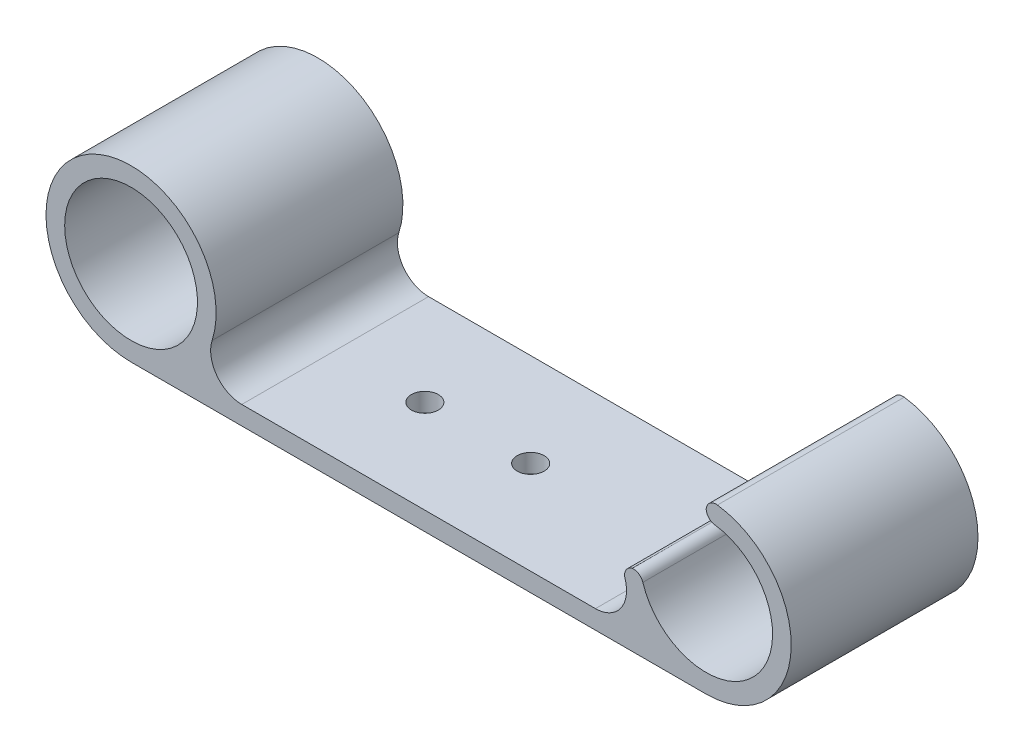
from build123d import *

# Parameters (mm, degrees)
SKETCH3_W           = 114.3
SKETCH3_H           = 38.1
BOSS_EXTRUDE1_DEPTH = 3.81
SKETCH4_R           = 13.5453125
BOSS_EXTRUDE2_DEPTH = 19.05
FILLET1_R           = 2.032
SKETCH5_R           = 2.749999961
CUT_EXTRUDE4_DEPTH  = 12.7


with BuildPart() as part:
    # Sketch3 → Boss-Extrude1 (new body)
    with BuildSketch(Plane(origin=(0, 0, 0), x_dir=(1, 0, 0), z_dir=(0, 1, 0))):
        Rectangle(SKETCH3_W, SKETCH3_H)
    extrude(amount=BOSS_EXTRUDE1_DEPTH)

    # Sketch4 → Boss-Extrude2 (add, symmetric)
    with BuildSketch(Plane.XY):
        with BuildLine():
            Line((-36.071859255, 3.81), (36.071859255, 3.81))
            ThreePointArc((36.071859255, 3.81), (41.198342199, 6.412778013), (42.122274879, 12.087425946))
            ThreePointArc((42.122274879, 12.087425946), (41.806974837, 13.2052175), (41.567140999, 14.341594112))
            Line((41.567140999, 14.341594112), (45.319258538, 15.003193668))
            ThreePointArc((45.319258538, 15.003193668), (67.365546349, 6.979001129), (63.291557028, 30.083742702))
            ThreePointArc((63.291557028, 30.083742702), (61.010906137, 30.694841267), (58.658787305, 30.900625))
            Line((58.658787305, 30.900625), (58.658787305, 34.710625))
            ThreePointArc((58.658787305, 34.710625), (61.672505693, 34.446958806), (64.594653774, 33.663971588))
            ThreePointArc((64.594653774, 33.663971588), (75.750433611, 14.341594112), (58.658787305, 0))
            Line((58.658787305, 0), (-58.658787305, 0))
            ThreePointArc((-58.658787305, 0), (-70.930846463, 5.083253342), (-76.014099805, 17.3553125))
            ThreePointArc((-76.014099805, 17.3553125), (-55.993216901, 34.504703346), (-42.122274879, 12.087425946))
            ThreePointArc((-42.122274879, 12.087425946), (-41.198342199, 6.412778013), (-36.071859255, 3.81))
        make_face()
        with Locations(Location((-58.658787305, 17.3553125, 0), (0, 0, 180))):
            Circle(SKETCH4_R, mode=Mode.SUBTRACT)
    extrude(amount=BOSS_EXTRUDE2_DEPTH, both=True)

    # Fillet1
    # the kernel refuses this fillet: 2.032 mm, written as the material it takes off along each edge
    with BuildSketch(Plane(origin=(58.658787305, 34.710625, 0), x_dir=(0, -1, 0), z_dir=(0, 0, -1)), Plane(origin=(41.567140999, 14.341594112, 0), x_dir=(0.9848077530122078, 0.17364817766693208, 0), z_dir=(0, 0, 1))) as fillet1_piece_1:
        with BuildLine():
            CenterArc((2.16732771, -2.032), FILLET1_R, 90, 97.620348072)
            ThreePointArc((0.153273302, -2.301460275), (0.03836072, -1.153279249), (0, 0))
            Line((0, 0), (2.16732771, 0))
        make_face()
    extrude(amount=24.816396244, mode=Mode.SUBTRACT)
    with BuildSketch(Plane(origin=(58.658787305, 30.900625, 0), x_dir=(0.9978615634411592, -0.06536283505758803, 0), z_dir=(0, 0, -1)), Plane(origin=(45.319258538, 15.003193668, 0), x_dir=(0.23764666877900192, -0.9713516669148425, 0), z_dir=(0, 0, 1))) as fillet1_piece_2:
        with BuildLine():
            CenterArc((1.903537334, -2.027654697), FILLET1_R, 93.747686363, 82.504627273)
            Line((-0.124117363, -1.894837416), (0, 0))
            ThreePointArc((0, 0), (0.885360027, -0.028965791), (1.770720053, 0))
        make_face()
    extrude(amount=23.797245223, mode=Mode.SUBTRACT)
    with BuildSketch(Plane(origin=(45.319258538, 15.003193668, 0), x_dir=(-0.9848077530122076, -0.17364817766693288, 0), z_dir=(0, 0, -1)), Plane(origin=(58.658787305, 30.900625, 0), x_dir=(0, 1, 0), z_dir=(0, 0, 1))) as fillet1_piece_3:
        with BuildLine():
            CenterArc((1.898898089, -2.032), FILLET1_R, 90, 82.504627273)
            ThreePointArc((-0.115739283, -1.766933481), (-0.028965791, -0.885360027), (0, 0))
            Line((0, 0), (1.898898089, 0))
        make_face()
    extrude(amount=23.797245223, mode=Mode.SUBTRACT)
    with BuildSketch(Plane(origin=(41.567140999, 14.341594112, 0), x_dir=(0.23870589854739682, -0.9710919081110089, 0), z_dir=(0, 0, -1)), Plane(origin=(58.658787305, 34.710625, 0), x_dir=(0.9977896842762429, -0.06645107938864023, 0), z_dir=(0, 0, 1))) as fillet1_piece_4:
        with BuildLine():
            CenterArc((2.171529904, -2.027508638), FILLET1_R, 86.189825964, 97.620348072)
            Line((0.144021266, -2.162537232), (0, 0))
            ThreePointArc((0, 0), (1.153279249, 0.03836072), (2.306558498, 0))
        make_face()
    extrude(amount=24.816396244, mode=Mode.SUBTRACT)

    # Sketch5 → Cut-Extrude4 (cut)
    with BuildSketch(Plane(origin=(0, 3.81, 0), x_dir=(1, 0, 0), z_dir=(0, 1, 0))):
        with Locations(Location((-17.78, 0, 0), (0, 0, 270))):
            Circle(SKETCH5_R)
        with Locations(Location((3.81, 0, 0), (0, 0, 270))):
            Circle(SKETCH5_R)
    extrude(amount=-CUT_EXTRUDE4_DEPTH, mode=Mode.SUBTRACT)


solid = part.part
